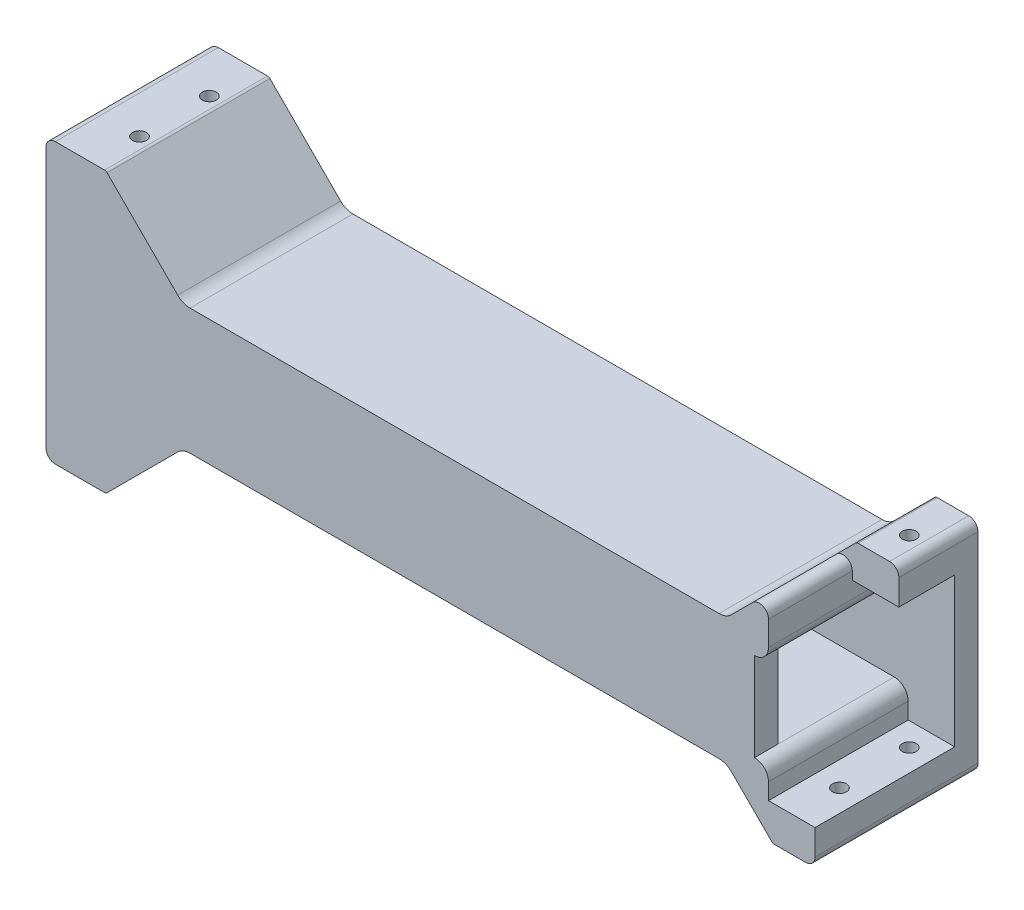
from build123d import *

# Parameters (mm, degrees)
EXTRUDE_1_DEPTH          = 35
SKETCH_3_W               = 25
SKETCH_3_H               = 19
CUT_EXTRUDE_1_DEPTH      = 181.230887126
SKETCH_4_W               = 25
SKETCH_4_H               = 12.5
CUT_EXTRUDE_2_DEPTH      = 13.5
SKETCH_5_W               = 25
SKETCH_5_H               = 32
CUT_EXTRUDE_3_DEPTH      = 10
FILLET_1_R               = 3
FILLET_2_R               = 2
CUT_EXTRUDE_4_DEPTH      = 191.354670013
CUT_EXTRUDE_4_DEPTH_BACK = 191.354670013
SKETCH_6_R               = 1.5
CUT_EXTRUDE_5_DEPTH      = 189.803867534
CUT_EXTRUDE_5_DEPTH_BACK = 189.803867534
SKETCH_7_R               = 1.5
SKETCH_8_W               = 13.5
SKETCH_8_H               = 44
SKETCH_8_W_2             = 10
SKETCH_8_H_2             = 32
CUT_EXTRUDE_6_DEPTH      = 193.807936548
CUT_EXTRUDE_7_DEPTH      = 10
CUT_EXTRUDE_8_DEPTH      = 18
FILLET_3_R               = 2
SKETCH_11_W              = 10
SKETCH_11_H              = 32
EXTRUDE_2_DEPTH          = 5
CUT_EXTRUDE_10_DEPTH     = 5


with BuildPart() as part:
    # 草图1 → 凸台-拉伸1 (new body)
    with BuildSketch(Plane.XY):
        with BuildLine():
            Line((42.832374142, 47.594424801), (27.642544089, 62.784254855))
            ThreePointArc((27.642544089, 62.784254855), (27.40357385, 62.943929664), (27.121689234, 63))
            Line((27.121689234, 63), (14.544073956, 63))
            Line((14.544073956, 63), (14.544073956, 3))
            Line((14.544073956, 3), (27.121689234, 3))
            ThreePointArc((27.121689234, 3), (27.40357385, 3.056070336), (27.642544089, 3.215745145))
            Line((27.642544089, 3.215745145), (42.832374142, 18.405575199))
            ThreePointArc((42.832374142, 18.405575199), (44.044614428, 19.215568261), (45.474549341, 19.5))
            Line((45.474549341, 19.5), (159.121689234, 19.5))
            ThreePointArc((159.121689234, 19.5), (160.551624147, 19.215568261), (161.763864432, 18.405575199))
            Line((161.763864432, 18.405575199), (170.453694486, 9.715745145))
            ThreePointArc((170.453694486, 9.715745145), (170.692664725, 9.556070336), (170.974549341, 9.5))
            Line((170.974549341, 9.5), (179.738422147, 9.5))
            Line((179.738422147, 9.5), (179.738422147, 56.5))
            Line((179.738422147, 56.5), (170.974549341, 56.5))
            ThreePointArc((170.974549341, 56.5), (170.692664725, 56.443929664), (170.453694486, 56.284254855))
            Line((170.453694486, 56.284254855), (161.763864432, 47.594424801))
            ThreePointArc((161.763864432, 47.594424801), (160.551624147, 46.784431739), (159.121689234, 46.5))
            Line((159.121689234, 46.5), (45.474549341, 46.5))
            ThreePointArc((45.474549341, 46.5), (44.044614428, 46.784431739), (42.832374142, 47.594424801))
        make_face()
    extrude(amount=EXTRUDE_1_DEPTH)

    # 草图3 → 切除-拉伸1 (cut, through all)
    with BuildSketch(Plane.ZY.offset(-14.544073956)):
        with Locations((17.5, 33)):
            Rectangle(SKETCH_3_W, SKETCH_3_H)
    extrude(amount=-CUT_EXTRUDE_1_DEPTH, mode=Mode.SUBTRACT)

    # 草图4 → 切除-拉伸2 (cut)
    with BuildSketch(Plane.ZY.offset(-14.544073956)):
        with Locations((17.5, 48.75)):
            Rectangle(SKETCH_4_W, SKETCH_4_H)
        with Locations((17.5, 17.25)):
            Rectangle(SKETCH_4_W, SKETCH_4_H)
    extrude(amount=-CUT_EXTRUDE_2_DEPTH, mode=Mode.SUBTRACT)

    # 草图5 → 切除-拉伸3 (cut)
    with BuildSketch(Plane(origin=(179.738422147, 0, 0), x_dir=(0, 0, -1), z_dir=(1, 0, 0))):
        with Locations((-17.5, 33)):
            Rectangle(SKETCH_5_W, SKETCH_5_H)
    extrude(amount=-CUT_EXTRUDE_3_DEPTH, mode=Mode.SUBTRACT)

    # 圆角1
    fillet_1_edges = [part.edges().sort_by_distance(p)[0] for p in [
        (169.738422147, 23.5, 17.5),
        (169.738422147, 42.5, 17.5),
        (28.044073956, 42.5, 17.5),
        (28.044073956, 23.5, 17.5),
    ]]
    fillet(fillet_1_edges, radius=FILLET_1_R)

    # 圆角2
    fillet_2_edges = [part.edges().sort_by_distance(p)[0] for p in [
        (179.738422147, 56.5, 17.5),
        (179.738422147, 9.5, 17.5),
        (14.544073956, 63, 17.5),
        (14.544073956, 3, 17.5),
    ]]
    fillet(fillet_2_edges, radius=FILLET_2_R)

    # 草图6 → 切除-拉伸4 (cut, two sides: drawn at the far end of the back side and taken through both)
    with BuildSketch(Plane.XZ.offset(-55).offset(-CUT_EXTRUDE_4_DEPTH_BACK)):
        with Locations((24.621689234, 25)):
            Circle(SKETCH_6_R)
        with Locations((24.621689234, 10)):
            Circle(SKETCH_6_R)
    extrude(amount=CUT_EXTRUDE_4_DEPTH + CUT_EXTRUDE_4_DEPTH_BACK, mode=Mode.SUBTRACT)

    # 草图7 → 切除-拉伸5 (cut, two sides: drawn at the far end of the back side and taken through both)
    with BuildSketch(Plane.XZ.offset(-49).offset(-CUT_EXTRUDE_5_DEPTH_BACK)):
        with Locations((174.974549341, 25)):
            Circle(SKETCH_7_R)
        with Locations((174.974549341, 10)):
            Circle(SKETCH_7_R)
    extrude(amount=CUT_EXTRUDE_5_DEPTH + CUT_EXTRUDE_5_DEPTH_BACK, mode=Mode.SUBTRACT)

    # 草图8 → 切除-拉伸6 (cut, through all)
    with BuildSketch(Plane.XY.offset(5)):
        with Locations((21.294073956, 33)):
            Rectangle(SKETCH_8_W, SKETCH_8_H)
        with Locations((174.738422147, 33)):
            Rectangle(SKETCH_8_W_2, SKETCH_8_H_2)
    extrude(amount=-CUT_EXTRUDE_6_DEPTH, mode=Mode.SUBTRACT)

    # 草图9 → 切除-拉伸7 (cut)
    with BuildSketch(Plane(origin=(0, 0, 30), x_dir=(-1, 0, 0), z_dir=(0, 0, -1))):
        Polygon((-169.738422147, 49), (-179.738422147, 49), (-179.738422147, 17), (-169.738422147, 17), (-169.738422147, 20.5), (-169.738422147, 45.5), align=None)
    extrude(amount=-CUT_EXTRUDE_7_DEPTH, mode=Mode.SUBTRACT)

    # 草图10 → 切除-拉伸8 (cut)
    with BuildSketch(Plane.XY.offset(35)):
        with BuildLine():
            Line((169.738422147, 55.568982516), (169.738422147, 49))
            Line((169.738422147, 49), (179.738422147, 49))
            Line((179.738422147, 49), (179.738422147, 54.5))
            ThreePointArc((179.738422147, 54.5), (179.15263571, 55.914213562), (177.738422147, 56.5))
            Line((177.738422147, 56.5), (170.974549341, 56.5))
            ThreePointArc((170.974549341, 56.5), (170.692664725, 56.443929664), (170.453694486, 56.284254855))
            Line((170.453694486, 56.284254855), (169.738422147, 55.568982516))
        make_face()
    extrude(amount=-CUT_EXTRUDE_8_DEPTH, mode=Mode.SUBTRACT)

    # 圆角3
    fillet_3_edges = [part.edges().sort_by_distance(p)[0] for p in [
        (169.738422147, 55.568982516, 26),
    ]]
    fillet(fillet_3_edges, radius=FILLET_3_R)

    # 草图11 → 凸台-拉伸2 (add)
    with BuildSketch(Plane(origin=(0, 0, 0), x_dir=(-1, 0, 0), z_dir=(0, 0, -1))):
        with Locations((-174.738422147, 33)):
            Rectangle(SKETCH_11_W, SKETCH_11_H)
    extrude(amount=-EXTRUDE_2_DEPTH)

    # 草图12 → 切除-拉伸10 (cut)
    with BuildSketch(Plane(origin=(0, 0, 30), x_dir=(-1, 0, 0), z_dir=(0, 0, -1))):
        with BuildLine():
            Line((-166.738422147, 23.5), (-166.738422147, 42.5))
            ThreePointArc((-166.738422147, 42.5), (-168.859742491, 43.378679656), (-169.738422147, 45.5))
            Line((-169.738422147, 45.5), (-169.738422147, 20.5))
            ThreePointArc((-169.738422147, 20.5), (-168.859742491, 22.621320344), (-166.738422147, 23.5))
        make_face()
    extrude(amount=-CUT_EXTRUDE_10_DEPTH, mode=Mode.SUBTRACT)


solid = part.part
